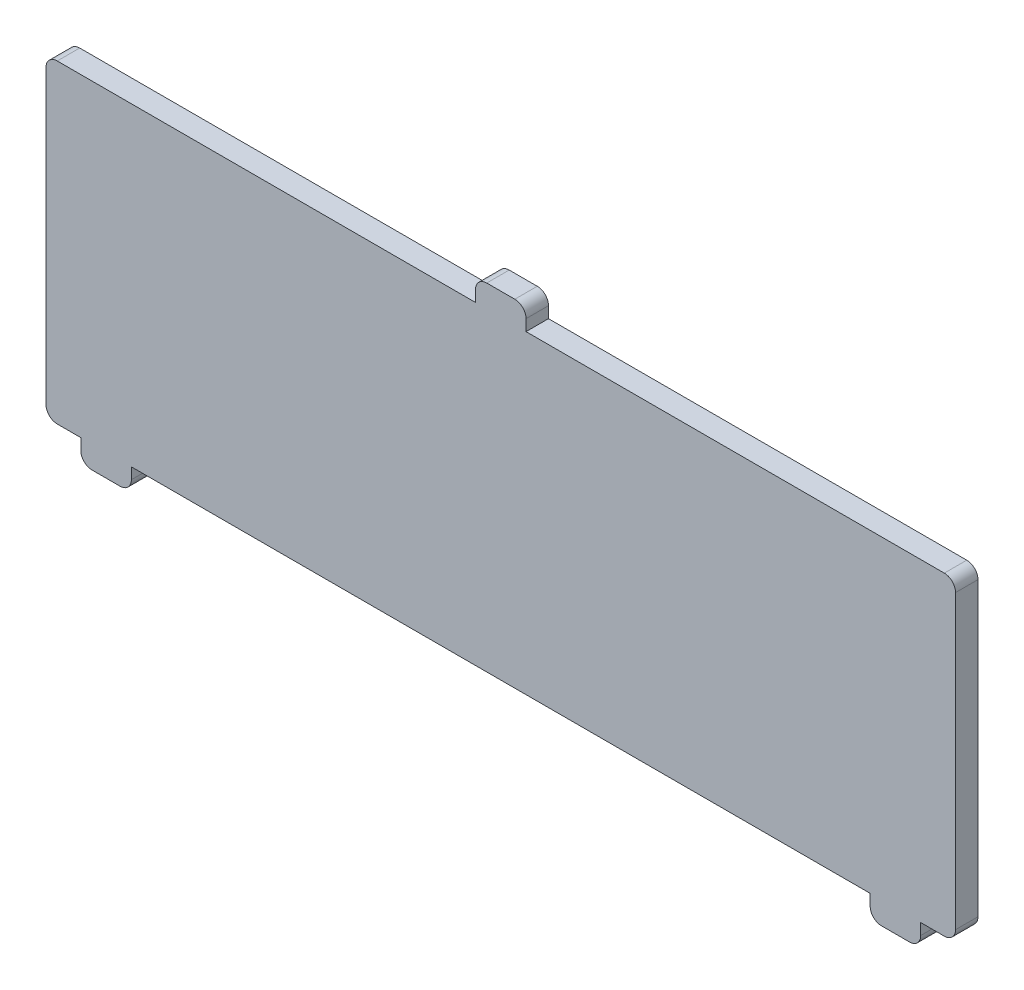
from build123d import *

# Parameters (mm, degrees)
BOSS_EXTRUDE1_DEPTH = 1
FILLET1_R           = 1


with BuildPart() as part:
    # Sketch1 → Boss-Extrude1 (new, symmetric)
    with BuildSketch(Plane.XY):
        Polygon((-2.25, 14), (-40.5, 14), (-40.5, -14), (-37.4, -14), (-37.4, -16), (-32.9, -16), (-32.9, -14), (32.9, -14), (32.9, -16), (37.4, -16), (37.4, -14), (40.5, -14), (40.5, 14), (2.25, 14), (2.25, 16), (-2.25, 16), align=None)
    extrude(amount=BOSS_EXTRUDE1_DEPTH, both=True)

    # Fillet1
    fillet1_edges = [part.edges().sort_by_distance(p)[0] for p in [
        (-40.5, 14, 0),
        (-32.9, -16, 0),
        (-37.4, -16, 0),
        (-40.5, -14, 0),
        (32.9, -16, 0),
        (37.4, -16, 0),
        (40.5, -14, 0),
        (40.5, 14, 0),
        (2.25, 16, 0),
        (-2.25, 16, 0),
    ]]
    fillet(fillet1_edges, radius=FILLET1_R)


solid = part.part
